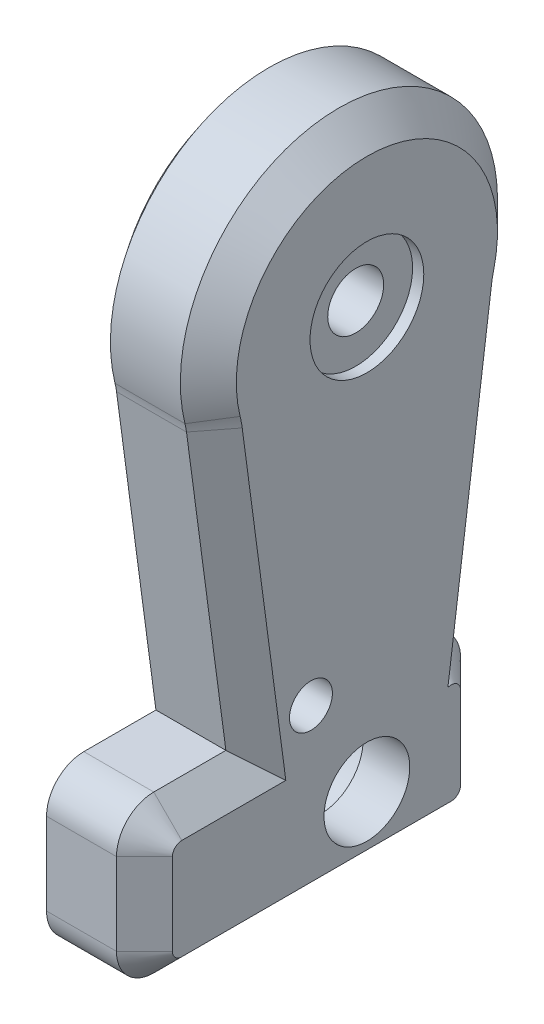
from build123d import *

# Parameters (mm, degrees)
BOSS_EXTRUDE1_START  = 65.9
BOSS_EXTRUDE1_DEPTH  = 10.5
BOSS_EXTRUDE2_START  = 65.8
BOSS_EXTRUDE2_DEPTH  = 0.6
CHAMFER1_SIZE        = 3
CHAMFER2_SIZE        = 3
BOSS_EXTRUDE3_START  = -55.3
SKETCH3_W            = 2.3
SKETCH3_H            = 23
BOSS_EXTRUDE3_DEPTH  = 6.6
BOSS_EXTRUDE4_START  = -63.5
SKETCH4_W            = 2.3
SKETCH4_H            = 6.6
BOSS_EXTRUDE4_DEPTH  = 23
BOSS_EXTRUDE5_START  = 65.9
SKETCH5_R            = 4.6
BOSS_EXTRUDE5_DEPTH  = 2.3
BOSS_EXTRUDE6_START  = 75.2
SKETCH6_R            = 6.1
BOSS_EXTRUDE6_DEPTH  = 1.7
BOSS_EXTRUDE7_START  = 68.1
SKETCH7_R            = 3
BOSS_EXTRUDE7_DEPTH  = 7.2
BOSS_EXTRUDE8_START  = -52.9
SKETCH8_W            = 6.1
SKETCH8_H            = 1.1
BOSS_EXTRUDE8_DEPTH  = 1.8
BOSS_EXTRUDE9_START  = -46.5
SKETCH9_W            = 6.1
SKETCH9_H            = 1.8
BOSS_EXTRUDE9_DEPTH  = 1.1
BOSS_EXTRUDE10_START = -52.9
SKETCH10_W           = 6.1
SKETCH10_H           = 1.1
BOSS_EXTRUDE10_DEPTH = 1.8
BOSS_EXTRUDE11_START = -58.6
SKETCH11_W           = 6.1
SKETCH11_H           = 1.8
BOSS_EXTRUDE11_DEPTH = 1.1
BOSS_EXTRUDE12_START = -52.9
SKETCH12_W           = 7.3
SKETCH12_H           = 3.4
BOSS_EXTRUDE12_DEPTH = 1.8
BOSS_EXTRUDE13_START = -45.4
SKETCH13_W           = 7.3
SKETCH13_H           = 1.8
BOSS_EXTRUDE13_DEPTH = 3.4
BOSS_EXTRUDE14_START = -52.9
SKETCH14_W           = 7.3
SKETCH14_H           = 3.4
BOSS_EXTRUDE14_DEPTH = 1.8
BOSS_EXTRUDE15_START = -62
SKETCH15_W           = 7.3
SKETCH15_H           = 1.8
BOSS_EXTRUDE15_DEPTH = 3.4
BOSS_EXTRUDE16_START = 64.4
BOSS_EXTRUDE16_DEPTH = 2.05
BOSS_EXTRUDE17_START = -62.125
SKETCH17_W           = 4.1
SKETCH17_H           = 2
BOSS_EXTRUDE17_DEPTH = 2.9
BOSS_EXTRUDE18_START = -33.975
SKETCH18_W           = 4.1
SKETCH18_H           = 2
BOSS_EXTRUDE18_DEPTH = 2.9
BOSS_EXTRUDE19_START = -58.3
SKETCH19_W           = 2.1
SKETCH19_H           = 13
BOSS_EXTRUDE19_DEPTH = 23.4
BOSS_EXTRUDE20_START = 66.3
SKETCH20_R           = 6.7
BOSS_EXTRUDE20_DEPTH = 5.1
BOSS_EXTRUDE21_START = 71.1
SKETCH21_R           = 4.6
BOSS_EXTRUDE21_DEPTH = 5.8
BOSS_EXTRUDE22_START = -55
SKETCH22_W           = 8.3
SKETCH22_H           = 20.8
BOSS_EXTRUDE22_DEPTH = 6
BOSS_EXTRUDE23_START = 70.9
SKETCH23_R           = 2.3
BOSS_EXTRUDE23_DEPTH = 6
BOSS_EXTRUDE24_START = 66.3
SKETCH24_R           = 1.3
BOSS_EXTRUDE24_DEPTH = 4.65
BOSS_EXTRUDE25_START = -60.6
SKETCH25_W           = 4.1
SKETCH25_H           = 4.1
BOSS_EXTRUDE25_DEPTH = 2.2
BOSS_EXTRUDE26_START = -47.75
BOSS_EXTRUDE26_DEPTH = 3.5
BOSS_EXTRUDE27_START = -45.6
SKETCH27_W           = 4.1
SKETCH27_H           = 4.1
BOSS_EXTRUDE27_DEPTH = 2.2
BOSS_EXTRUDE28_START = -47.75
BOSS_EXTRUDE28_DEPTH = 3.5


with BuildPart() as part:
    # Sketch1 → Boss-Extrude1 (new body)
    with BuildSketch(Plane(origin=(0, 0, 0), x_dir=(0, 0, -1), z_dir=(1, 0, 0)).offset(BOSS_EXTRUDE1_START)):
        with BuildLine():
            Line((68.342706479, -24.929701405), (63.95350661, -57.848700423))
            ThreePointArc((63.95350661, -57.848700423), (64.765778952, -59.119126346), (65.05, -60.6))
            Line((65.05, -60.6), (65.05, -69.4))
            ThreePointArc((65.05, -69.4), (63.878427125, -72.228427125), (61.05, -73.4))
            Line((61.05, -73.4), (32.15, -73.4))
            ThreePointArc((32.15, -73.4), (29.321572875, -72.228427125), (28.15, -69.4))
            Line((28.15, -69.4), (28.15, -60.6))
            ThreePointArc((28.15, -60.6), (29.321572875, -57.771572875), (32.15, -56.6))
            Line((32.15, -56.6), (39.88, -56.6))
            Line((39.88, -56.6), (35.657293521, -24.929701405))
            ThreePointArc((35.657293521, -24.929701405), (35.587717068, -24.49821266), (35.494679814, -24.071167593))
            ThreePointArc((35.494679814, -24.071167593), (52, -3), (68.505320186, -24.071167593))
            ThreePointArc((68.505320186, -24.071167593), (68.412282932, -24.49821266), (68.342706479, -24.929701405))
        make_face()
    extrude(amount=BOSS_EXTRUDE1_DEPTH)


with BuildPart() as body_2:
    # Sketch2 → Boss-Extrude2 (new body)
    with BuildSketch(Plane(origin=(0, 0, 0), x_dir=(0, 0, -1), z_dir=(1, 0, 0)).offset(BOSS_EXTRUDE2_START)):
        with BuildLine():
            Line((67.549724159, -24.823970429), (63.106481591, -58.148289686))
            ThreePointArc((63.106481591, -58.148289686), (63.950063887, -59.247362039), (64.25, -60.6))
            Line((64.25, -60.6), (64.25, -69.4))
            ThreePointArc((64.25, -69.4), (63.3127417, -71.6627417), (61.05, -72.6))
            Line((61.05, -72.6), (32.15, -72.6))
            ThreePointArc((32.15, -72.6), (29.8872583, -71.6627417), (28.95, -69.4))
            Line((28.95, -69.4), (28.95, -60.6))
            ThreePointArc((28.95, -60.6), (29.8872583, -58.3372583), (32.15, -57.4))
            Line((32.15, -57.4), (40.793746451, -57.4))
            Line((40.793746451, -57.4), (36.450275841, -24.823970429))
            ThreePointArc((36.450275841, -24.823970429), (36.373741743, -24.34933281), (36.271400764, -23.879583236))
            ThreePointArc((36.271400764, -23.879583236), (52, -3.8), (67.728599236, -23.879583236))
            ThreePointArc((67.728599236, -23.879583236), (67.626258257, -24.34933281), (67.549724159, -24.823970429))
        make_face()
    extrude(amount=BOSS_EXTRUDE2_DEPTH)


with BuildPart() as part_1:
    add(part.part)

    # Combine1: cut body 2
    add(body_2.part, mode=Mode.SUBTRACT)

    # Chamfer1
    chamfer1_edges = [part_1.edges().sort_by_distance(p)[0] for p in [
        (76.4, -41.389200914, -66.148106545),
        (76.4, -40.764850703, -37.76864676),
        (76.4, -24.49821266, -68.412282932),
        (76.4, -24.49821266, -35.587717068),
        (76.4, -3, -52),
    ]]
    chamfer(chamfer1_edges, length=CHAMFER1_SIZE)

    # Chamfer2
    chamfer2_edges = [part_1.edges().sort_by_distance(p)[0] for p in [
        (76.4, -56.6, -37.528274595),
        (76.4, -57.771572875, -29.321572875),
        (76.4, -57.786965833, -63.893736763),
        (76.4, -65, -28.15),
        (76.4, -65, -65.05),
        (76.4, -72.228427125, -29.321572875),
        (76.4, -72.228427125, -63.878427125),
        (76.4, -73.4, -46.6),
    ]]
    chamfer(chamfer2_edges, length=CHAMFER2_SIZE)


with BuildPart() as body_2_2:
    # Sketch3 → Boss-Extrude3 (new body)
    with BuildSketch(Plane.XY.offset(BOSS_EXTRUDE3_START)):
        with Locations((67.05, -20)):
            Rectangle(SKETCH3_W, SKETCH3_H)
    extrude(amount=BOSS_EXTRUDE3_DEPTH)


with BuildPart() as part_2:
    add(part_1.part)

    # Combine2: cut body 2 2
    add(body_2_2.part, mode=Mode.SUBTRACT)


with BuildPart() as body_2_3:
    # Sketch4 → Boss-Extrude4 (new body)
    with BuildSketch(Plane.XY.offset(BOSS_EXTRUDE4_START)):
        with Locations((67.05, -20)):
            Rectangle(SKETCH4_W, SKETCH4_H)
    extrude(amount=BOSS_EXTRUDE4_DEPTH)


with BuildPart() as part_3:
    add(part_2.part)

    # Combine3: cut body 2 3
    add(body_2_3.part, mode=Mode.SUBTRACT)


with BuildPart() as body_2_4:
    # Sketch5 → Boss-Extrude5 (new body)
    with BuildSketch(Plane(origin=(0, 0, 0), x_dir=(0, 0, -1), z_dir=(1, 0, 0)).offset(BOSS_EXTRUDE5_START)):
        with Locations((52, -20)):
            Circle(SKETCH5_R)
    extrude(amount=BOSS_EXTRUDE5_DEPTH)


with BuildPart() as part_4:
    add(part_3.part)

    # Combine4: cut body 2 4
    add(body_2_4.part, mode=Mode.SUBTRACT)


with BuildPart() as body_2_5:
    # Sketch6 → Boss-Extrude6 (new body)
    with BuildSketch(Plane(origin=(0, 0, 0), x_dir=(0, 0, -1), z_dir=(1, 0, 0)).offset(BOSS_EXTRUDE6_START)):
        with Locations((52, -20)):
            Circle(SKETCH6_R)
    extrude(amount=BOSS_EXTRUDE6_DEPTH)


with BuildPart() as part_5:
    add(part_4.part)

    # Combine5: cut body 2 5
    add(body_2_5.part, mode=Mode.SUBTRACT)


with BuildPart() as body_2_6:
    # Sketch7 → Boss-Extrude7 (new body)
    with BuildSketch(Plane(origin=(0, 0, 0), x_dir=(0, 0, -1), z_dir=(1, 0, 0)).offset(BOSS_EXTRUDE7_START)):
        with Locations((52, -20)):
            Circle(SKETCH7_R)
    extrude(amount=BOSS_EXTRUDE7_DEPTH)


with BuildPart() as part_6:
    add(part_5.part)

    # Combine6: cut body 2 6
    add(body_2_6.part, mode=Mode.SUBTRACT)


with BuildPart() as body_2_7:
    # Sketch8 → Boss-Extrude8 (new body)
    with BuildSketch(Plane.XY.offset(BOSS_EXTRUDE8_START)):
        with Locations((71.15, -13.95)):
            Rectangle(SKETCH8_W, SKETCH8_H)
    extrude(amount=BOSS_EXTRUDE8_DEPTH)


with BuildPart() as part_7:
    add(part_6.part)

    # Combine7: cut body 2 7
    add(body_2_7.part, mode=Mode.SUBTRACT)


with BuildPart() as body_2_8:
    # Sketch9 → Boss-Extrude9 (new body)
    with BuildSketch(Plane.XY.offset(BOSS_EXTRUDE9_START)):
        with Locations((71.15, -20)):
            Rectangle(SKETCH9_W, SKETCH9_H)
    extrude(amount=BOSS_EXTRUDE9_DEPTH)


with BuildPart() as part_8:
    add(part_7.part)

    # Combine8: cut body 2 8
    add(body_2_8.part, mode=Mode.SUBTRACT)


with BuildPart() as body_2_9:
    # Sketch10 → Boss-Extrude10 (new body)
    with BuildSketch(Plane.XY.offset(BOSS_EXTRUDE10_START)):
        with Locations((71.15, -26.05)):
            Rectangle(SKETCH10_W, SKETCH10_H)
    extrude(amount=BOSS_EXTRUDE10_DEPTH)


with BuildPart() as part_9:
    add(part_8.part)

    # Combine9: cut body 2 9
    add(body_2_9.part, mode=Mode.SUBTRACT)


with BuildPart() as body_2_10:
    # Sketch11 → Boss-Extrude11 (new body)
    with BuildSketch(Plane.XY.offset(BOSS_EXTRUDE11_START)):
        with Locations((71.15, -20)):
            Rectangle(SKETCH11_W, SKETCH11_H)
    extrude(amount=BOSS_EXTRUDE11_DEPTH)


with BuildPart() as part_10:
    add(part_9.part)

    # Combine10: cut body 2 10
    add(body_2_10.part, mode=Mode.SUBTRACT)


with BuildPart() as body_2_11:
    # Sketch12 → Boss-Extrude12 (new body)
    with BuildSketch(Plane.XY.offset(BOSS_EXTRUDE12_START)):
        with Locations((71.75, -11.7)):
            Rectangle(SKETCH12_W, SKETCH12_H)
    extrude(amount=BOSS_EXTRUDE12_DEPTH)


with BuildPart() as part_11:
    add(part_10.part)

    # Combine11: cut body 2 11
    add(body_2_11.part, mode=Mode.SUBTRACT)


with BuildPart() as body_2_12:
    # Sketch13 → Boss-Extrude13 (new body)
    with BuildSketch(Plane.XY.offset(BOSS_EXTRUDE13_START)):
        with Locations((71.75, -20)):
            Rectangle(SKETCH13_W, SKETCH13_H)
    extrude(amount=BOSS_EXTRUDE13_DEPTH)


with BuildPart() as part_12:
    add(part_11.part)

    # Combine12: cut body 2 12
    add(body_2_12.part, mode=Mode.SUBTRACT)


with BuildPart() as body_2_13:
    # Sketch14 → Boss-Extrude14 (new body)
    with BuildSketch(Plane.XY.offset(BOSS_EXTRUDE14_START)):
        with Locations((71.75, -28.3)):
            Rectangle(SKETCH14_W, SKETCH14_H)
    extrude(amount=BOSS_EXTRUDE14_DEPTH)


with BuildPart() as part_13:
    add(part_12.part)

    # Combine13: cut body 2 13
    add(body_2_13.part, mode=Mode.SUBTRACT)


with BuildPart() as body_2_14:
    # Sketch15 → Boss-Extrude15 (new body)
    with BuildSketch(Plane.XY.offset(BOSS_EXTRUDE15_START)):
        with Locations((71.75, -20)):
            Rectangle(SKETCH15_W, SKETCH15_H)
    extrude(amount=BOSS_EXTRUDE15_DEPTH)


with BuildPart() as part_14:
    add(part_13.part)

    # Combine14: cut body 2 14
    add(body_2_14.part, mode=Mode.SUBTRACT)

    # Sketch16 → Boss-Extrude16 (add)
    with BuildSketch(Plane(origin=(0, 0, 0), x_dir=(0, 0, -1), z_dir=(1, 0, 0)).offset(BOSS_EXTRUDE16_START)):
        with BuildLine():
            Line((66.095389312, -14.86969785), (65.531573739, -15.074909936))
            ThreePointArc((65.531573739, -15.074909936), (52, -5.6), (38.468426261, -15.074909936))
            Line((38.468426261, -15.074909936), (37.904610688, -14.86969785))
            ThreePointArc((37.904610688, -14.86969785), (52, -5), (66.095389312, -14.86969785))
        make_face()
    extrude(amount=BOSS_EXTRUDE16_DEPTH)


with BuildPart() as body_2_15:
    # Sketch17 → Boss-Extrude17 (new body)
    with BuildSketch(Plane.XY.offset(BOSS_EXTRUDE17_START)):
        with Locations((68.35, -65)):
            Rectangle(SKETCH17_W, SKETCH17_H)
    extrude(amount=BOSS_EXTRUDE17_DEPTH)


with BuildPart() as part_15:
    add(part_14.part)

    # Combine15: cut body 2 15
    add(body_2_15.part, mode=Mode.SUBTRACT)


with BuildPart() as body_2_16:
    # Sketch18 → Boss-Extrude18 (new body)
    with BuildSketch(Plane.XY.offset(BOSS_EXTRUDE18_START)):
        with Locations((68.35, -65)):
            Rectangle(SKETCH18_W, SKETCH18_H)
    extrude(amount=BOSS_EXTRUDE18_DEPTH)


with BuildPart() as part_16:
    add(part_15.part)

    # Combine16: cut body 2 16
    add(body_2_16.part, mode=Mode.SUBTRACT)


with BuildPart() as body_2_17:
    # Sketch19 → Boss-Extrude19 (new body)
    with BuildSketch(Plane.XY.offset(BOSS_EXTRUDE19_START)):
        with Locations((67.35, -65)):
            Rectangle(SKETCH19_W, SKETCH19_H)
    extrude(amount=BOSS_EXTRUDE19_DEPTH)


with BuildPart() as part_17:
    add(part_16.part)

    # Combine17: cut body 2 17
    add(body_2_17.part, mode=Mode.SUBTRACT)


with BuildPart() as body_2_18:
    # Sketch20 → Boss-Extrude20 (new body)
    with BuildSketch(Plane(origin=(0, 0, 0), x_dir=(0, 0, -1), z_dir=(1, 0, 0)).offset(BOSS_EXTRUDE20_START)):
        with Locations((52, -65)):
            Circle(SKETCH20_R)
    extrude(amount=BOSS_EXTRUDE20_DEPTH)


with BuildPart() as part_18:
    add(part_17.part)

    # Combine18: cut body 2 18
    add(body_2_18.part, mode=Mode.SUBTRACT)


with BuildPart() as body_2_19:
    # Sketch21 → Boss-Extrude21 (new body)
    with BuildSketch(Plane(origin=(0, 0, 0), x_dir=(0, 0, -1), z_dir=(1, 0, 0)).offset(BOSS_EXTRUDE21_START)):
        with Locations((52, -65)):
            Circle(SKETCH21_R)
    extrude(amount=BOSS_EXTRUDE21_DEPTH)


with BuildPart() as part_19:
    add(part_18.part)

    # Combine19: cut body 2 19
    add(body_2_19.part, mode=Mode.SUBTRACT)


with BuildPart() as body_2_20:
    # Sketch22 → Boss-Extrude22 (new body)
    with BuildSketch(Plane.XY.offset(BOSS_EXTRUDE22_START)):
        with Locations((70.45, -47.4)):
            Rectangle(SKETCH22_W, SKETCH22_H)
    extrude(amount=BOSS_EXTRUDE22_DEPTH)


with BuildPart() as part_20:
    add(part_19.part)

    # Combine20: cut body 2 20
    add(body_2_20.part, mode=Mode.SUBTRACT)


with BuildPart() as body_2_21:
    # Sketch23 → Boss-Extrude23 (new body)
    with BuildSketch(Plane(origin=(0, 0, 0), x_dir=(0, 0, -1), z_dir=(1, 0, 0)).offset(BOSS_EXTRUDE23_START)):
        with Locations((46, -54)):
            Circle(SKETCH23_R)
    extrude(amount=BOSS_EXTRUDE23_DEPTH)


with BuildPart() as part_21:
    add(part_20.part)

    # Combine21: cut body 2 21
    add(body_2_21.part, mode=Mode.SUBTRACT)


with BuildPart() as body_2_22:
    # Sketch24 → Boss-Extrude24 (new body)
    with BuildSketch(Plane(origin=(0, 0, 0), x_dir=(0, 0, -1), z_dir=(1, 0, 0)).offset(BOSS_EXTRUDE24_START)):
        with Locations((46, -54)):
            Circle(SKETCH24_R)
    extrude(amount=BOSS_EXTRUDE24_DEPTH)


with BuildPart() as part_22:
    add(part_21.part)

    # Combine22: cut body 2 22
    add(body_2_22.part, mode=Mode.SUBTRACT)


with BuildPart() as body_2_23:
    # Sketch25 → Boss-Extrude25 (new body)
    with BuildSketch(Plane.XY.offset(BOSS_EXTRUDE25_START)):
        with Locations((68.35, -46)):
            Rectangle(SKETCH25_W, SKETCH25_H)
    extrude(amount=BOSS_EXTRUDE25_DEPTH)


with BuildPart() as part_23:
    add(part_22.part)

    # Combine23: cut body 2 23
    add(body_2_23.part, mode=Mode.SUBTRACT)

    # Sketch26 → Boss-Extrude26 (add)
    with BuildSketch(Plane(origin=(0, 0, 0), x_dir=(1, 0, 0), z_dir=(0, 1, 0)).offset(BOSS_EXTRUDE26_START)):
        Polygon((70.6, 59), (70.6, 60), (64.4, 60), (64.4, 60.4), (63.8, 60.4), (63, 59.6), (63, 59), align=None)
    extrude(amount=BOSS_EXTRUDE26_DEPTH)


with BuildPart() as body_2_24:
    # Sketch27 → Boss-Extrude27 (new body)
    with BuildSketch(Plane.XY.offset(BOSS_EXTRUDE27_START)):
        with Locations((68.35, -46)):
            Rectangle(SKETCH27_W, SKETCH27_H)
    extrude(amount=BOSS_EXTRUDE27_DEPTH)


with BuildPart() as part_24:
    add(part_23.part)

    # Combine24: cut body 2 24
    add(body_2_24.part, mode=Mode.SUBTRACT)

    # Sketch28 → Boss-Extrude28 (add)
    with BuildSketch(Plane(origin=(0, 0, 0), x_dir=(1, 0, 0), z_dir=(0, 1, 0)).offset(BOSS_EXTRUDE28_START)):
        Polygon((70.6, 45), (70.6, 44), (64.4, 44), (64.4, 43.6), (63.8, 43.6), (63, 44.4), (63, 45), align=None)
    extrude(amount=BOSS_EXTRUDE28_DEPTH)


solid = part_24.part
